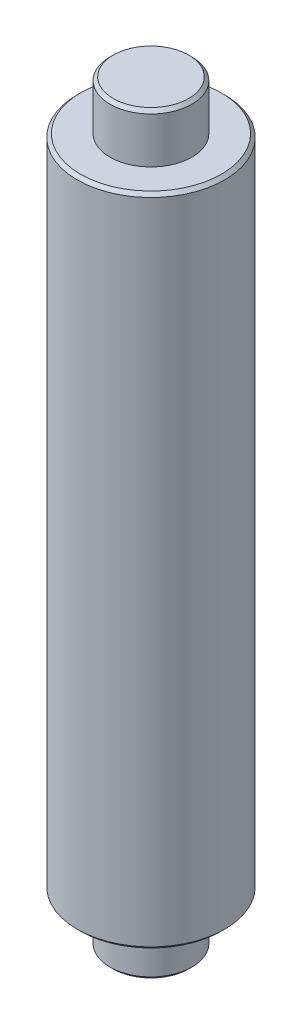
from build123d import *

# Parameters (mm, degrees)
SKETCH1_R           = 2.5
BOSS_EXTRUDE1_DEPTH = 46
CHAMFER1_SIZE       = 0.2
SKETCH2_R           = 4.5
BOSS_EXTRUDE2_DEPTH = 20
CHAMFER2_SIZE       = 0.2


with BuildPart() as part:
    # Sketch1 → Boss-Extrude1 (new body)
    with BuildSketch(Plane(origin=(0, 0, 0), x_dir=(1, 0, 0), z_dir=(0, 1, 0))):
        Circle(SKETCH1_R)
    extrude(amount=BOSS_EXTRUDE1_DEPTH)

    # Chamfer1
    chamfer1_edges = [part.edges().sort_by_distance(p)[0] for p in [
        (-2.5, 46, 0),
        (-2.5, 0, 0),
    ]]
    chamfer(chamfer1_edges, length=CHAMFER1_SIZE)

    # Sketch2 → Boss-Extrude2 (add, symmetric)
    with BuildSketch(Plane(origin=(0, 23, 0), x_dir=(1, 0, 0), z_dir=(0, 1, 0))):
        Circle(SKETCH2_R)
    extrude(amount=BOSS_EXTRUDE2_DEPTH, both=True)

    # Chamfer2
    chamfer2_edges = [part.edges().sort_by_distance(p)[0] for p in [
        (-4.5, 3, 0),
        (-4.5, 43, 0),
    ]]
    chamfer(chamfer2_edges, length=CHAMFER2_SIZE)


solid = part.part
